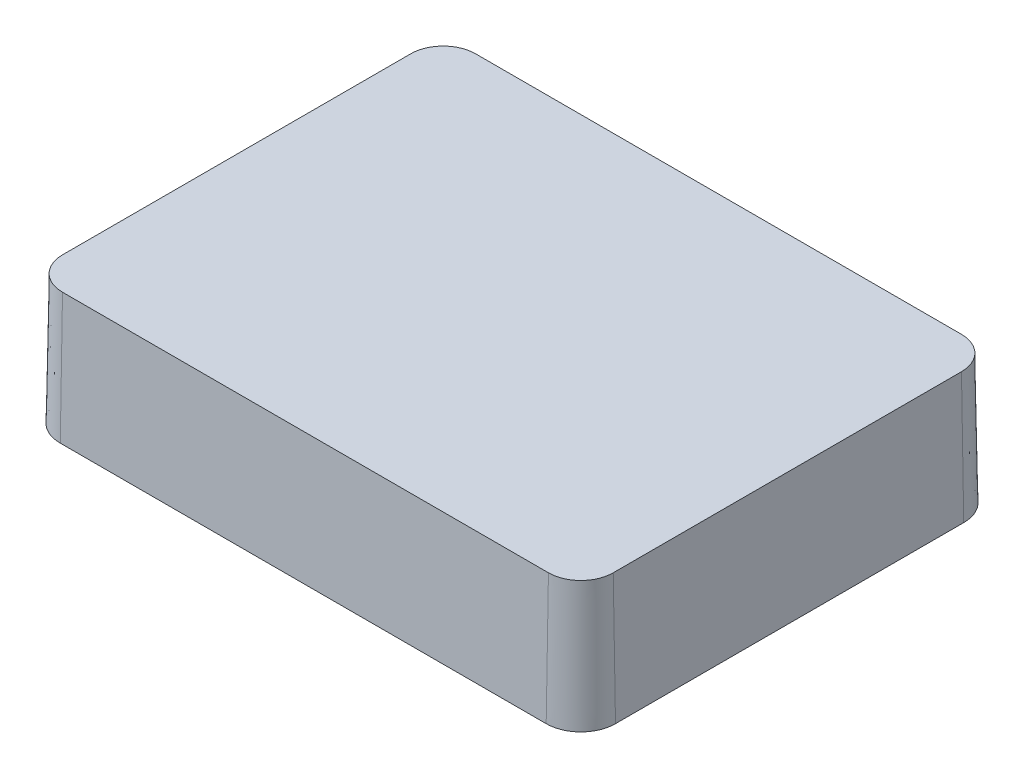
from build123d import *

# Parameters (mm, degrees)
BOSS_EXTRUDE1_DEPTH = 4
BOSS_EXTRUDE1_DRAFT = 1
SHELL1_T            = -0.5
SKETCH2_R           = 2
BOSS_EXTRUDE2_DEPTH = 5.5
BOSS_EXTRUDE2_TAPER = 1.5
CIRPATTERN1_COUNT   = 4
SKETCH4_R           = 1.605977431
CUT_EXTRUDE1_DEPTH  = 5.5
CUT_EXTRUDE1_DRAFT  = 1.5


with BuildPart() as part:
    # Sketch1 → Boss-Extrude1 (with draft: the straight prism first)
    with BuildSketch(Plane(origin=(0, 0, 0), x_dir=(1, 0, 0), z_dir=(0, 1, 0))):
        with BuildLine():
            Line((-7.5, -6.375), (7.5, -6.375))
            ThreePointArc((7.5, -6.375), (8.207106781, -6.082106781), (8.5, -5.375))
            Line((8.5, -5.375), (8.5, 5.375))
            ThreePointArc((8.5, 5.375), (8.207106781, 6.082106781), (7.5, 6.375))
            Line((7.5, 6.375), (-7.5, 6.375))
            ThreePointArc((-7.5, 6.375), (-8.207106781, 6.082106781), (-8.5, 5.375))
            Line((-8.5, 5.375), (-8.5, -5.375))
            ThreePointArc((-8.5, -5.375), (-8.207106781, -6.082106781), (-7.5, -6.375))
        make_face()
    extrude(amount=-BOSS_EXTRUDE1_DEPTH)
    # Boss-Extrude1: the draft: its side faces are tilted about the plane it starts from
    boss_extrude1_sides = [part.faces().sort_by_distance(p)[0] for p in [
        (0, -2, 6.375),
        (8.207106781, -2, 6.082106781),
        (8.5, -2, 0),
        (8.207106781, -2, -6.082106781),
        (0, -2, -6.375),
        (-8.207106781, -2, -6.082106781),
        (-8.5, -2, 0),
        (-8.207106781, -2, 6.082106781),
    ]]
    draft(boss_extrude1_sides, Plane(origin=(0, 0, 0), x_dir=(1, 0, 0), z_dir=(0, 1, 0)), BOSS_EXTRUDE1_DRAFT)

    # Shell1
    shell1_openings = [part.faces().sort_by_distance(p)[0] for p in [
        (0, -4, 0),
    ]]
    offset(amount=SHELL1_T, openings=shell1_openings, kind=Kind.INTERSECTION)

    # Sketch2 → Boss-Extrude2 (add)
    with BuildSketch(Plane.XZ.offset(0.5)):
        Circle(SKETCH2_R)
    extrude(amount=BOSS_EXTRUDE2_DEPTH, taper=BOSS_EXTRUDE2_TAPER)

    # Rib1: read off the stored shape, not the designer's step
    # Rib1: loft between two sections, ruled curve by curve
    rib1_from = [
        Edge.make_line((1.982008139, -0.5, 0.267663478), (3, -0.5, 0.25)),
        Edge.make_line((1.982008139, -0.5, -0.267663478), (3, -0.5, -0.25)),
        Edge.make_line((3, -0.5, -0.25), (3, -0.5, 0.25)),
        Edge.make_line((1.982008139, -0.5, -0.267663478), (1.982008139, -0.5, 0.267663478)),
    ]
    rib1_to = [
        Edge.make_line((1.837716138, -6, 0.259714502), (2.397587968, -6, 0.25)),
        Edge.make_line((1.837716138, -6, -0.259714502), (2.397587968, -6, -0.25)),
        Edge.make_line((2.397587968, -6, -0.25), (2.397587968, -6, 0.25)),
        Edge.make_line((1.837716138, -6, -0.259714502), (1.837716138, -6, 0.259714502)),
    ]
    rib1 = Solid(Shell([*[Face.make_surface_from_curves(rib1_from[k], rib1_to[k]) for k in range(4)], Face(Wire(rib1_from)), Face(Wire(rib1_to))]))
    add(rib1)

    # CirPattern1: Rib1 ×4 about axis
    cirpattern1_axis = Axis((0, 0, 0), (0, 1, 0))
    for i in range(1, CIRPATTERN1_COUNT):
        add(rib1.rotate(cirpattern1_axis, i * 360 / CIRPATTERN1_COUNT))


with BuildPart() as cut_extrude1_tool:
    # Sketch4 → Cut-Extrude1 (with draft: the straight prism first)
    with BuildSketch(Plane.XZ.offset(6)):
        Circle(SKETCH4_R)
    extrude(amount=-CUT_EXTRUDE1_DEPTH)
    # Cut-Extrude1: the draft: its side faces are tilted about the plane it starts from
    cut_extrude1_sides = [cut_extrude1_tool.faces().sort_by_distance(p)[0] for p in [
        (-1.605977431, -3.25, 0),
    ]]
    draft(cut_extrude1_sides, Plane.XZ.offset(6), CUT_EXTRUDE1_DRAFT)


with BuildPart() as part_1:
    add(part.part)

    # Cut-Extrude1: cut by cut_extrude1_tool
    add(cut_extrude1_tool.part, mode=Mode.SUBTRACT)


solid = part_1.part
